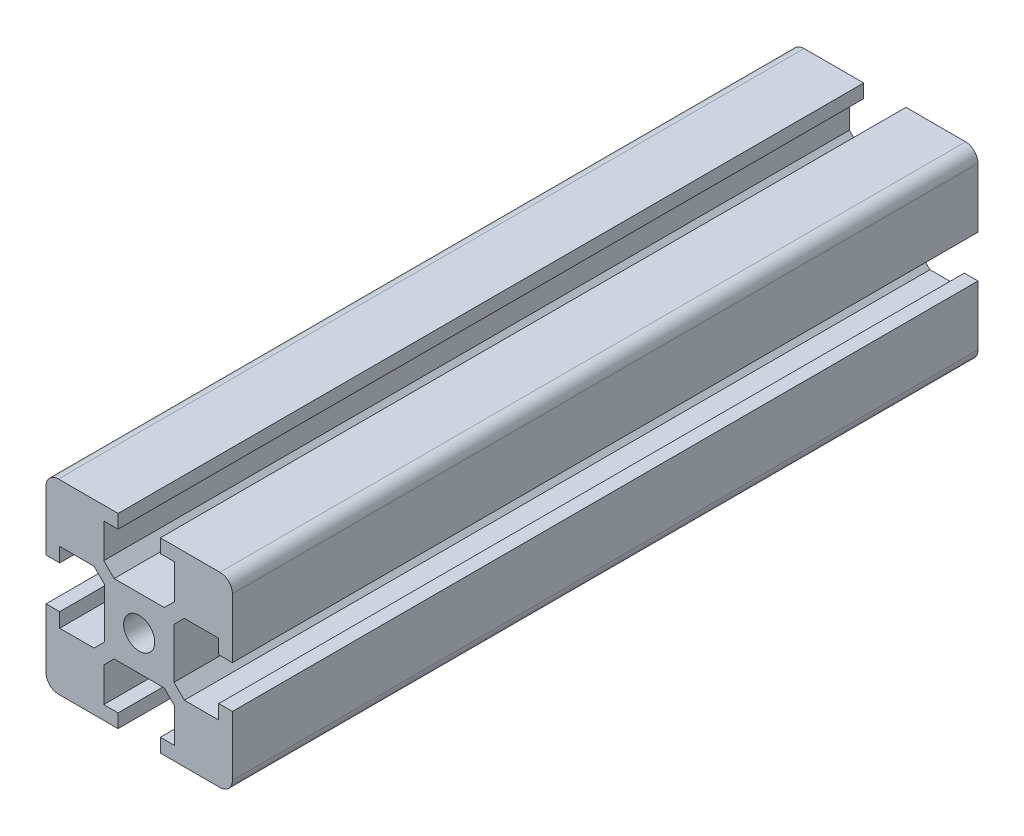
from build123d import *

# Parameters (mm, degrees)
SKETCH1_R           = 1.25
BOSS_EXTRUDE1_DEPTH = 60
FILLET1_R           = 1


with BuildPart() as part:
    # Sketch1 → Boss-Extrude1 (new body)
    with BuildSketch(Plane.XY):
        Polygon((7.5, -7.5), (1.7, -7.5), (1.7, -6.4), (2.85, -6.4), (2.85, -3.63183498), (2.01816502, -2.8), (-2.01816502, -2.8), (-2.85, -3.63183498), (-2.85, -6.4), (-1.7, -6.4), (-1.7, -7.5), (-7.5, -7.5), (-7.5, -1.7), (-6.4, -1.7), (-6.4, -2.85), (-3.63183498, -2.85), (-2.8, -2.01816502), (-2.8, 2.01816502), (-3.63183498, 2.85), (-6.4, 2.85), (-6.4, 1.7), (-7.5, 1.7), (-7.5, 7.5), (-1.7, 7.5), (-1.7, 6.4), (-2.85, 6.4), (-2.85, 3.63183498), (-2.01816502, 2.8), (2.01816502, 2.8), (2.85, 3.63183498), (2.85, 6.4), (1.7, 6.4), (1.7, 7.5), (7.5, 7.5), (7.5, 1.7), (6.4, 1.7), (6.4, 2.85), (3.63183498, 2.85), (2.8, 2.01816502), (2.8, -2.01816502), (3.63183498, -2.85), (6.4, -2.85), (6.4, -1.7), (7.5, -1.7), align=None)
        Circle(SKETCH1_R, mode=Mode.SUBTRACT)
    extrude(amount=BOSS_EXTRUDE1_DEPTH)

    # Fillet1
    fillet1_edges = [part.edges().sort_by_distance(p)[0] for p in [
        (7.5, -7.5, 30),
        (-7.5, -7.5, 30),
        (7.5, 7.5, 30),
        (-7.5, 7.5, 30),
    ]]
    fillet(fillet1_edges, radius=FILLET1_R)


solid = part.part
